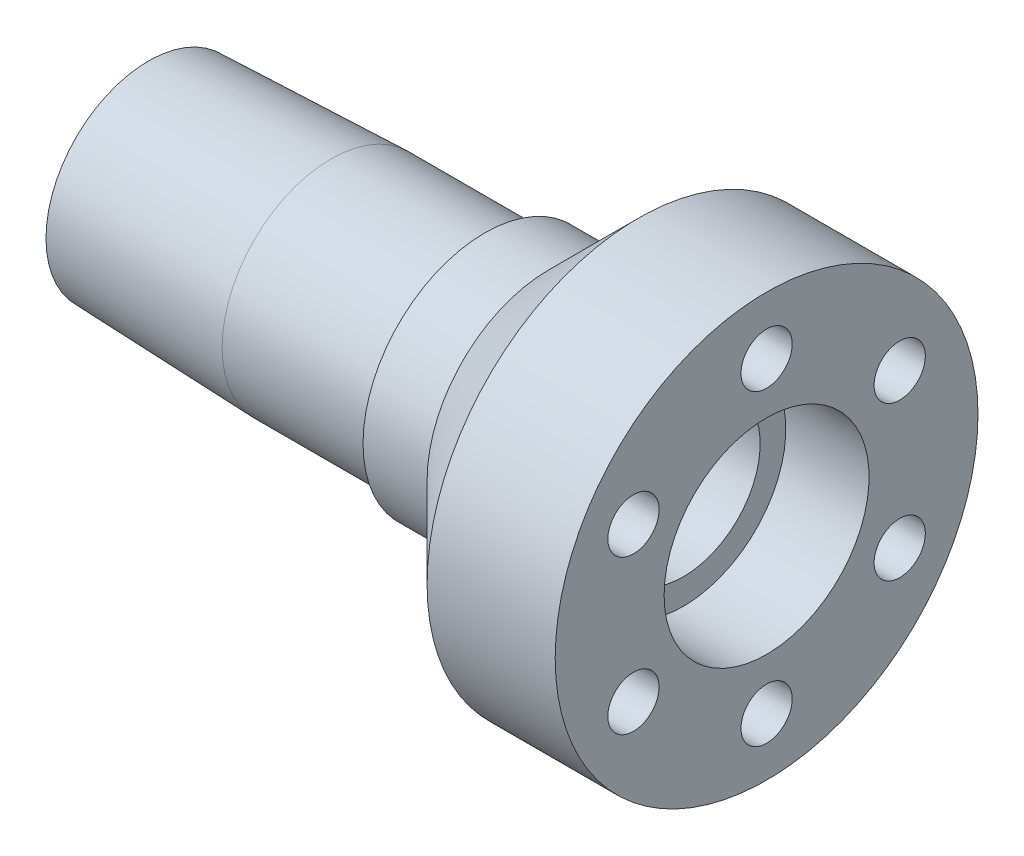
from build123d import *

# Parameters (mm, degrees)
SKETCH7_R          = 2
CUT_EXTRUDE2_DEPTH = 8


with BuildPart() as part:
    # Sketch2 → Revolve1 (revolve)
    with BuildSketch(Plane.XY):
        Polygon((0, 8), (0, 6), (41.75, 6), (41.75, 8), (48.25, 8), (48.25, 16.502402586), (38.25, 16.502402586), (31.247597414, 9.5), (26.247597414, 9.5), (26.247597414, 8.5), (14.247597414, 8.5), align=None)
    revolve(axis=Axis((0, 0, 0), (1, 0, 0)))

    # Sketch7 → Cut-Extrude2 (cut)
    with BuildSketch(Plane(origin=(48.25, 0, 0), x_dir=(0, 0, -1), z_dir=(1, 0, 0))):
        with Locations((0, 12)):
            Circle(SKETCH7_R)
        with Locations((10.392304845, 6)):
            Circle(SKETCH7_R)
        with Locations((10.392304845, -6)):
            Circle(SKETCH7_R)
        with Locations((0, -12)):
            Circle(SKETCH7_R)
        with Locations((-10.392304845, -6)):
            Circle(SKETCH7_R)
        with Locations((-10.392304845, 6)):
            Circle(SKETCH7_R)
    extrude(amount=-CUT_EXTRUDE2_DEPTH, mode=Mode.SUBTRACT)


solid = part.part
